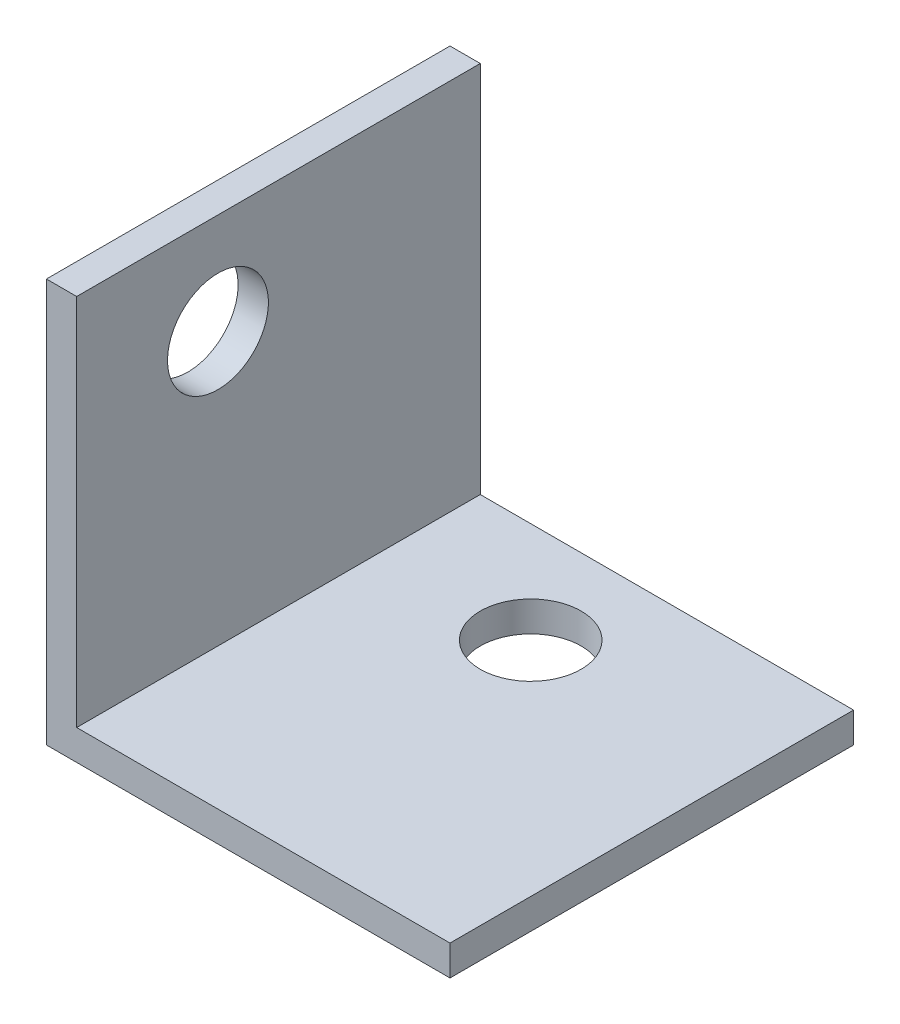
from build123d import *

# Parameters (mm, degrees)
EXTRUDE_THIN1_DEPTH = 20
SKETCH2_R           = 2.5
CUT_EXTRUDE1_DEPTH  = 35.641016151
SKETCH3_R           = 2.5
CUT_EXTRUDE2_DEPTH  = 34.797189232


with BuildPart() as part:
    # Sketch1 → Extrude-Thin1 (new body)
    with BuildSketch(Plane.XY):
        Polygon((0, 20), (0, 0), (20, 0), (20, 1.5), (1.5, 1.5), (1.5, 20), align=None)
    extrude(amount=EXTRUDE_THIN1_DEPTH)

    # Sketch2 → Cut-Extrude1 (cut, through all)
    with BuildSketch(Plane(origin=(0, 0, 0), x_dir=(-1, 0, 0), z_dir=(0, -1, 0))):
        with Locations((-9, -15)):
            Circle(SKETCH2_R)
    extrude(amount=-CUT_EXTRUDE1_DEPTH, mode=Mode.SUBTRACT)

    # Sketch3 → Cut-Extrude2 (cut, through all)
    with BuildSketch(Plane(origin=(1.5, 0, 0), x_dir=(0, 0, -1), z_dir=(1, 0, 0))):
        with Locations((-7, 15)):
            Circle(SKETCH3_R)
    extrude(amount=-CUT_EXTRUDE2_DEPTH, mode=Mode.SUBTRACT)


with BuildPart() as body_2:
    # Mirror1: mirrored copy
    add(part.part.mirror(Plane.XY))


solid = body_2.part
